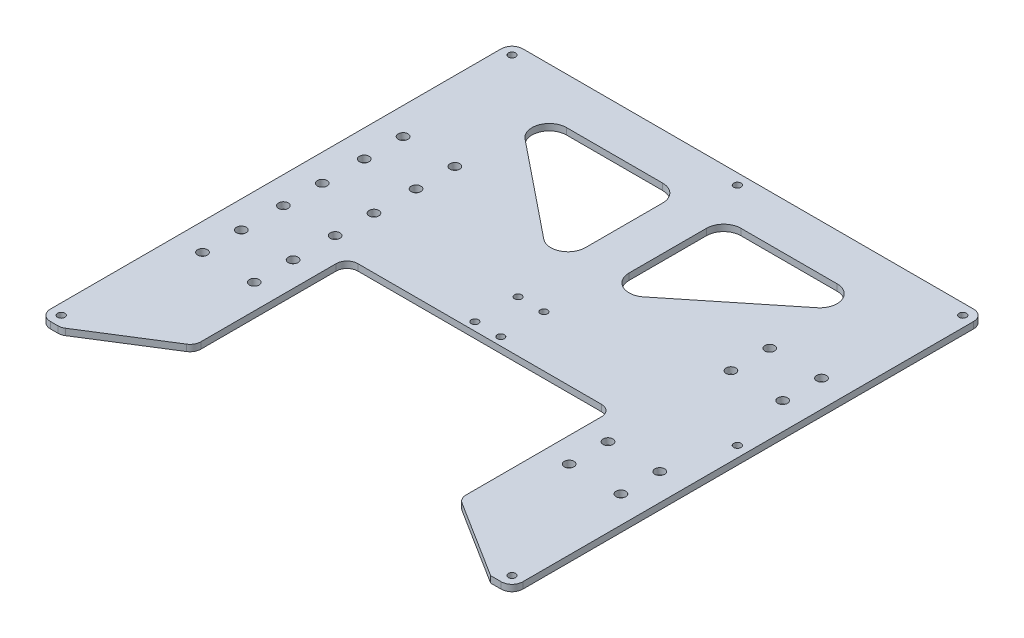
from build123d import *

# Parameters (mm, degrees)
SKETCH1_R           = 1.7
SKETCH1_R_2         = 2.25
SKETCH1_R_3         = 1.65
BOSS_EXTRUDE1_DEPTH = 3
FILLET1_R           = 5


with BuildPart() as part:
    # Sketch1 → Boss-Extrude1 (new body)
    with BuildSketch(Plane(origin=(0, 0, 0), x_dir=(1, 0, 0), z_dir=(0, 1, 0))):
        Polygon((-99.587138739, -109.5), (-61.5, -85.533985256), (-61.5, -15), (61.5, -15), (61.5, -85.533985256), (99.587138739, -109.5), (109.5, -109.5), (109.5, 109.5), (-109.5, 109.5), (-109.5, -109.5), align=None)
        with Locations((-104.5, 104.5)):
            Circle(SKETCH1_R, mode=Mode.SUBTRACT)
        with Locations((104.5, 104.5)):
            Circle(SKETCH1_R, mode=Mode.SUBTRACT)
        with Locations((104.5, -104.5)):
            Circle(SKETCH1_R, mode=Mode.SUBTRACT)
        with Locations((-104.5, -104.5)):
            Circle(SKETCH1_R, mode=Mode.SUBTRACT)
        with Locations((-97, 9)):
            Circle(SKETCH1_R_2, mode=Mode.SUBTRACT)
        with Locations((-73, 9)):
            Circle(SKETCH1_R_2, mode=Mode.SUBTRACT)
        with Locations((-73, -9)):
            Circle(SKETCH1_R_2, mode=Mode.SUBTRACT)
        with Locations((-97, -9)):
            Circle(SKETCH1_R_2, mode=Mode.SUBTRACT)
        with Locations((-97, 46.5)):
            Circle(SKETCH1_R_2, mode=Mode.SUBTRACT)
        with Locations((-73, 46.5)):
            Circle(SKETCH1_R_2, mode=Mode.SUBTRACT)
        with Locations((-73, 28.5)):
            Circle(SKETCH1_R_2, mode=Mode.SUBTRACT)
        with Locations((-97, 28.5)):
            Circle(SKETCH1_R_2, mode=Mode.SUBTRACT)
        with Locations((-97, -28.5)):
            Circle(SKETCH1_R_2, mode=Mode.SUBTRACT)
        with Locations((-73, -28.5)):
            Circle(SKETCH1_R_2, mode=Mode.SUBTRACT)
        with Locations((-73, -46.5)):
            Circle(SKETCH1_R_2, mode=Mode.SUBTRACT)
        with Locations((-97, -46.5)):
            Circle(SKETCH1_R_2, mode=Mode.SUBTRACT)
        with Locations((73, -46.5)):
            Circle(SKETCH1_R_2, mode=Mode.SUBTRACT)
        with Locations((97, -46.5)):
            Circle(SKETCH1_R_2, mode=Mode.SUBTRACT)
        with Locations((73, -28.5)):
            Circle(SKETCH1_R_2, mode=Mode.SUBTRACT)
        with Locations((97, -28.5)):
            Circle(SKETCH1_R_2, mode=Mode.SUBTRACT)
        with Locations((73, 28.5)):
            Circle(SKETCH1_R_2, mode=Mode.SUBTRACT)
        with Locations((97, 28.5)):
            Circle(SKETCH1_R_2, mode=Mode.SUBTRACT)
        with Locations((73, 46.5)):
            Circle(SKETCH1_R_2, mode=Mode.SUBTRACT)
        with Locations((97, 46.5)):
            Circle(SKETCH1_R_2, mode=Mode.SUBTRACT)
        with Locations((0, 104.5)):
            Circle(SKETCH1_R, mode=Mode.SUBTRACT)
        with Locations((104.5, 0)):
            Circle(SKETCH1_R, mode=Mode.SUBTRACT)
        with Locations((-6, 8.81582657)):
            Circle(SKETCH1_R_3, mode=Mode.SUBTRACT)
        with Locations((6, 8.81582657)):
            Circle(SKETCH1_R_3, mode=Mode.SUBTRACT)
        with Locations((6, -11.18417343)):
            Circle(SKETCH1_R_3, mode=Mode.SUBTRACT)
        with Locations((-6, -11.18417343)):
            Circle(SKETCH1_R_3, mode=Mode.SUBTRACT)
        with BuildLine():
            Line((-10.147064808, 80.005570394), (-10.147064808, 44.141462897))
            ThreePointArc((-10.147064808, 44.141462897), (-14.691860424, 36.926093006), (-23.162455474, 37.908818476))
            Line((-23.162455474, 37.908818476), (-67.730913723, 73.772925974))
            ThreePointArc((-67.730913723, 73.772925974), (-70.260758486, 82.664408922), (-62.715523057, 88.005570394))
            Line((-62.715523057, 88.005570394), (-18.147064808, 88.005570394))
            ThreePointArc((-18.147064808, 88.005570394), (-12.490210559, 85.662424644), (-10.147064808, 80.005570394))
        make_face(mode=Mode.SUBTRACT)
        with BuildLine():
            Line((10.147064808, 80.005570394), (10.147064808, 44.141462897))
            ThreePointArc((10.147064808, 44.141462897), (14.691860424, 36.926093006), (23.162455474, 37.908818476))
            Line((23.162455474, 37.908818476), (67.730913723, 73.772925974))
            ThreePointArc((67.730913723, 73.772925974), (70.260758486, 82.664408922), (62.715523057, 88.005570394))
            Line((62.715523057, 88.005570394), (18.147064808, 88.005570394))
            ThreePointArc((18.147064808, 88.005570394), (12.490210559, 85.662424644), (10.147064808, 80.005570394))
        make_face(mode=Mode.SUBTRACT)
    extrude(amount=BOSS_EXTRUDE1_DEPTH)

    # Fillet1
    fillet1_edges = [part.edges().sort_by_distance(p)[0] for p in [
        (-99.587138739, 1.5, 109.5),
        (109.5, 1.5, 109.5),
        (-109.5, 1.5, 109.5),
        (109.5, 1.5, -109.5),
        (-109.5, 1.5, -109.5),
        (61.5, 1.5, 85.533985256),
        (61.5, 1.5, 15),
        (-61.5, 1.5, 15),
        (-61.5, 1.5, 85.533985256),
    ]]
    fillet(fillet1_edges, radius=FILLET1_R)


solid = part.part
